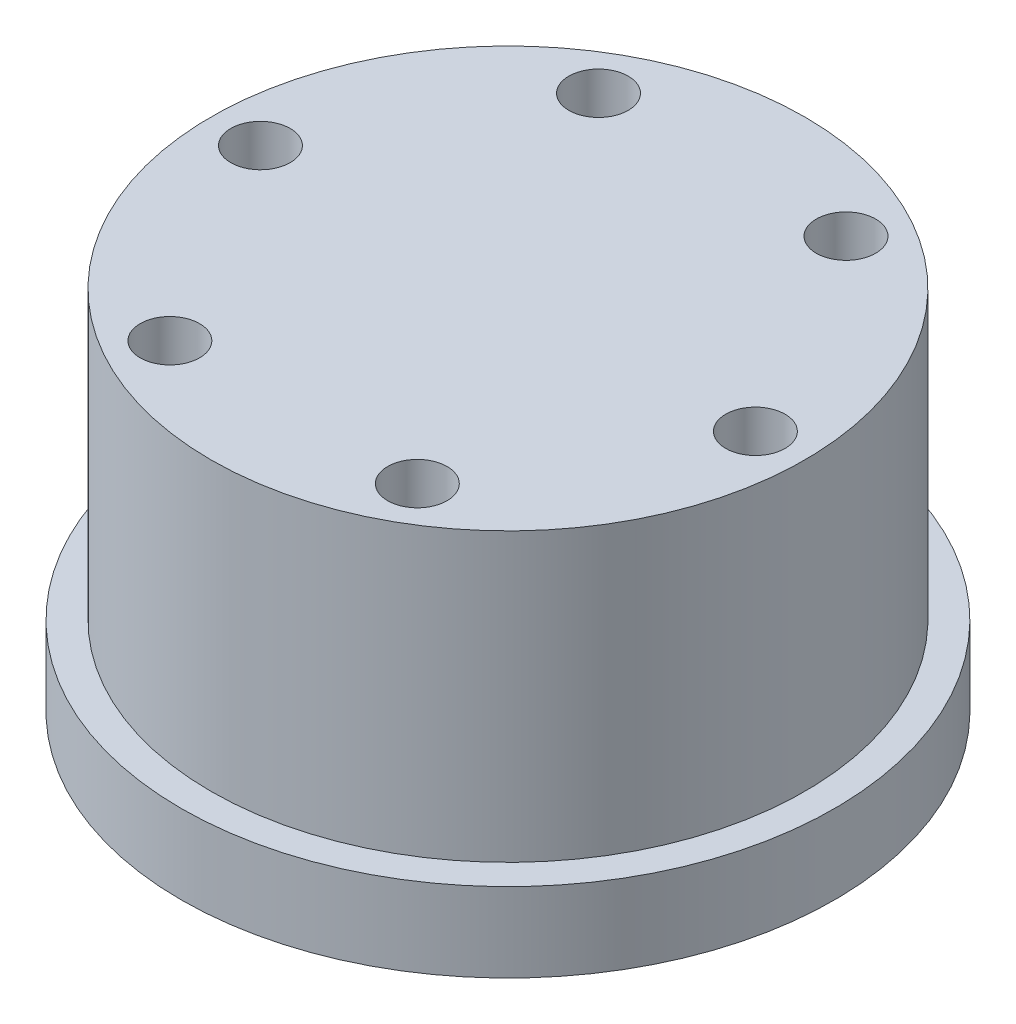
from build123d import *

# Parameters (mm, degrees)
SKETCH1_R           = 16.5
SKETCH1_R_2         = 1.5
BOSS_EXTRUDE1_DEPTH = 4
SKETCH2_R           = 15
BOSS_EXTRUDE2_DEPTH = 14.5
SKETCH3_R           = 9
CUT_EXTRUDE1_DEPTH  = 2
SKETCH4_R           = 6.5
CUT_EXTRUDE2_DEPTH  = 4
SKETCH5_R           = 1.5
CUT_EXTRUDE3_DEPTH  = 5


with BuildPart() as part:
    # Sketch1 → Boss-Extrude1 (new body)
    with BuildSketch(Plane(origin=(0, 0, 0), x_dir=(1, 0, 0), z_dir=(0, 1, 0))):
        Circle(SKETCH1_R)
        with Locations((0, 12.5)):
            Circle(SKETCH1_R_2, mode=Mode.SUBTRACT)
        with Locations((10.825317547, 6.25)):
            Circle(SKETCH1_R_2, mode=Mode.SUBTRACT)
        with Locations((10.825317547, -6.25)):
            Circle(SKETCH1_R_2, mode=Mode.SUBTRACT)
        with Locations((0, -12.5)):
            Circle(SKETCH1_R_2, mode=Mode.SUBTRACT)
        with Locations((-10.825317547, -6.25)):
            Circle(SKETCH1_R_2, mode=Mode.SUBTRACT)
        with Locations((-10.825317547, 6.25)):
            Circle(SKETCH1_R_2, mode=Mode.SUBTRACT)
    extrude(amount=BOSS_EXTRUDE1_DEPTH)

    # Sketch2 → Boss-Extrude2 (add)
    with BuildSketch(Plane(origin=(0, 4, 0), x_dir=(1, 0, 0), z_dir=(0, 1, 0))):
        Circle(SKETCH2_R)
    extrude(amount=BOSS_EXTRUDE2_DEPTH)

    # Sketch3 → Cut-Extrude1 (cut)
    with BuildSketch(Plane.XZ):
        Circle(SKETCH3_R)
    extrude(amount=-CUT_EXTRUDE1_DEPTH, mode=Mode.SUBTRACT)

    # Sketch4 → Cut-Extrude2 (cut)
    with BuildSketch(Plane.XZ.offset(-2)):
        Circle(SKETCH4_R)
    extrude(amount=-CUT_EXTRUDE2_DEPTH, mode=Mode.SUBTRACT)

    # Sketch5 → Cut-Extrude3 (cut)
    with BuildSketch(Plane(origin=(0, 18.5, 0), x_dir=(1, 0, 0), z_dir=(0, 1, 0))):
        with Locations((-12.5, 0)):
            Circle(SKETCH5_R)
        with Locations((-6.25, 10.825317547)):
            Circle(SKETCH5_R)
        with Locations((6.25, 10.825317547)):
            Circle(SKETCH5_R)
        with Locations((12.5, 0)):
            Circle(SKETCH5_R)
        with Locations((6.25, -10.825317547)):
            Circle(SKETCH5_R)
        with Locations((-6.25, -10.825317547)):
            Circle(SKETCH5_R)
    extrude(amount=-CUT_EXTRUDE3_DEPTH, mode=Mode.SUBTRACT)


solid = part.part
